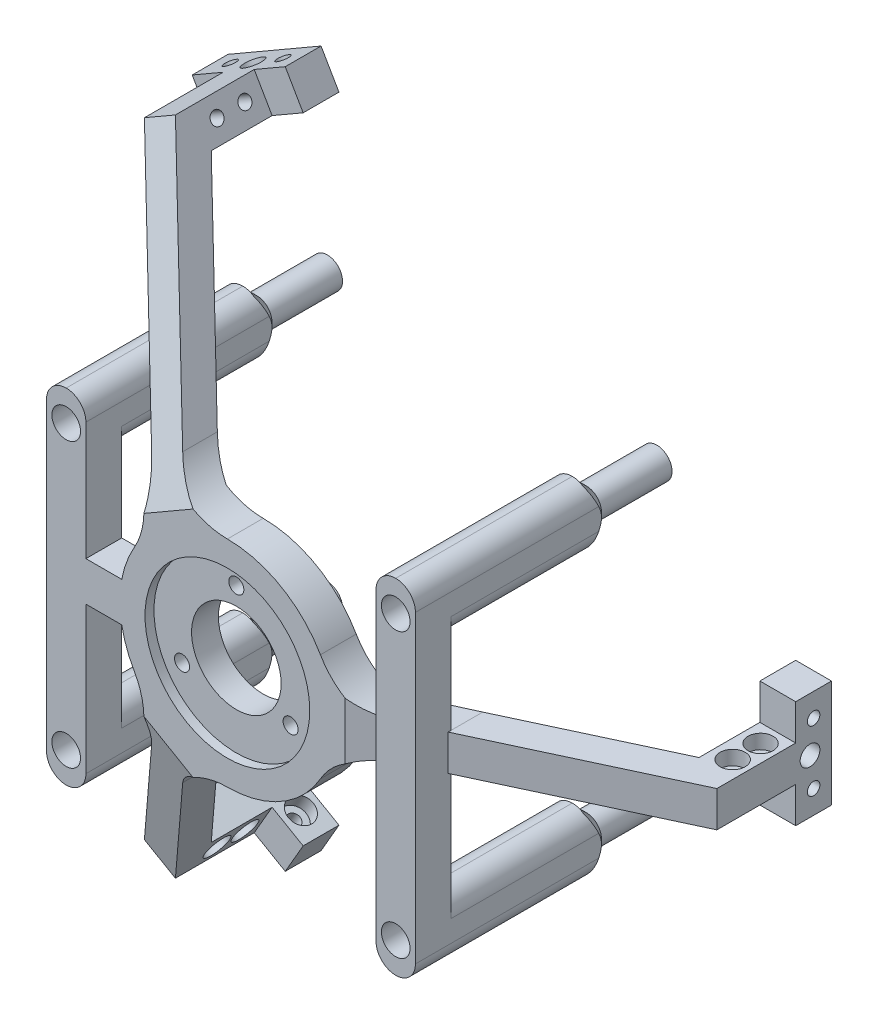
from build123d import *
from OCP.BRepFilletAPI import BRepFilletAPI_MakeChamfer

# Parameters (mm, degrees)
ESQUISSE1_W                    = 10
ESQUISSE1_H                    = 30
BOSS_EXTRU_1_DEPTH             = 10
BOSS_EXTRU_1_2_DEPTH           = 10
BOSS_EXTRU_1_3_DEPTH           = 10
ESQUISSE2_W                    = 10
ESQUISSE2_H                    = 10
BOSS_EXTRU_2_DEPTH             = 45
BOSS_EXTRU_3_DEPTH             = 10
CHANFREIN1_SIZE                = 28
CHANFREIN1_SIZE2               = 60.046193774
CHANFREIN2_SIZE                = 33
CHANFREIN2_SIZE2               = 70.768728377
CONG_1_R                       = 20
ENL_V_MAT_EXTRU_1_REACH        = 158.32
ESQUISSE4_R                    = 12.5
ESQUISSE5_R                    = 23
ENL_V_MAT_EXTRU_2_DEPTH        = 2.5
ENL_V_MAT_EXTRU_3_REACH        = 157.297
ESQUISSE6_R                    = 2.1
ESQUISSE7_W                    = 11
ESQUISSE7_H                    = 96
BOSS_EXTRU_4_DEPTH             = 39.3
BOSS_EXTRU_4_DIRECTION_2_REACH = 154.434
ENL_V_MAT_EXTRU_4_REACH        = 152.471
ESQUISSE8_R                    = 4
ESQUISSE18_R                   = 4.25
ESQUISSE18_R_2                 = 2.5
BOSS_EXTRU_6_DEPTH             = 15
CHANFREIN3_SIZE                = 3.9
ESQUISSE19_R                   = 4.25
ESQUISSE19_R_2                 = 1.5
BOSS_EXTRU_7_DEPTH             = 8.6
ESQUISSE10_W                   = 21.008475794
ESQUISSE10_H                   = 62
ESQUISSE10_W_2                 = 11
ENL_V_MAT_EXTRU_6_DEPTH        = 39.3
BOSS_EXTRU_5_REACH             = 157.459
CONG_2_R                       = 5.5
ENL_V_MAT_EXTRU_7_REACH        = 157.079
ESQUISSE11_R                   = 1.75
ESQUISSE12_R                   = 3.5
ENL_V_MAT_EXTRU_8_DEPTH        = 4
ENL_V_MAT_EXTRU_9_REACH        = 244.289
ESQUISSE13_R                   = 1.75
ESQUISSE14_R                   = 3.5
ENL_V_MAT_EXTRU_10_DEPTH       = 4
ENL_V_MAT_EXTRU_11_REACH       = 244.289
ESQUISSE15_R                   = 2.75
R_P_TITION_CIRCULAIRE1_COUNT   = 3


# Some blends are built 0.0001 mm under size
with BuildPart() as part:
    # Esquisse1 → Boss.-Extru.1 (new body)
    with BuildSketch(Plane.XY):
        with Locations((98.67, 0)):
            Rectangle(ESQUISSE1_W, ESQUISSE1_H)
    extrude(amount=BOSS_EXTRU_1_DEPTH)



with BuildPart() as body_2:
    # Esquisse1 → Boss.-Extru.1 2 (new body)
    with BuildSketch(Plane.XY):
        Polygon((-33.844618943, -88.620599572), (-59.825381057, -73.620599572), (-64.825381057, -82.28085361), (-38.844618943, -97.28085361), align=None)
    extrude(amount=BOSS_EXTRU_1_2_DEPTH)


with BuildPart() as body_3:
    # Esquisse1 → Boss.-Extru.1 3 (new body)
    with BuildSketch(Plane.XY):
        Polygon((-59.825381057, 73.620599572), (-33.844618943, 88.620599572), (-38.844618943, 97.28085361), (-64.825381057, 82.28085361), align=None)
    extrude(amount=BOSS_EXTRU_1_3_DEPTH)


with BuildPart() as part_1:
    add(part.part)

    add(body_2.part)  # Boss.-Extru.2 merges body 2

    add(body_3.part)  # Boss.-Extru.2 merges body 3
    # Esquisse2 → Boss.-Extru.2 (add)
    with BuildSketch(Plane.XY.offset(10)):
        Polygon((-47.504872981, 92.28085361), (-56.165127019, 87.28085361), (-51.165127019, 78.620599572), (-42.504872981, 83.620599572), align=None)
        with Locations((98.67, 0)):
            Rectangle(ESQUISSE2_W, ESQUISSE2_H)
        Polygon((-42.504872981, -83.620599572), (-51.165127019, -78.620599572), (-56.165127019, -87.28085361), (-47.504872981, -92.28085361), align=None)
    extrude(amount=BOSS_EXTRU_2_DEPTH)

    # Esquisse3 → Boss.-Extru.3 (add)
    with BuildSketch(Plane.XY.offset(55)):
        with BuildLine():
            Line((103.67, 5), (103.67, -5))
            Line((103.67, -5), (29.580398915, -5))
            ThreePointArc((29.580398915, -5), (15, -25.980762114), (-10.460072439, -28.117376915))
            Line((-10.460072439, -28.117376915), (-47.504872981, -92.28085361))
            Line((-47.504872981, -92.28085361), (-56.165127019, -87.28085361))
            Line((-56.165127019, -87.28085361), (-19.120326477, -23.117376915))
            ThreePointArc((-19.120326477, -23.117376915), (-30, 0), (-19.120326477, 23.117376915))
            Line((-19.120326477, 23.117376915), (-56.165127019, 87.28085361))
            Line((-56.165127019, 87.28085361), (-47.504872981, 92.28085361))
            Line((-47.504872981, 92.28085361), (-10.460072439, 28.117376915))
            ThreePointArc((-10.460072439, 28.117376915), (15, 25.980762114), (29.580398915, 5))
            Line((29.580398915, 5), (103.67, 5))
        make_face()
    extrude(amount=BOSS_EXTRU_3_DEPTH)

    # Chanfrein1: one chamfer whose edges measure the first distance from different faces: ONE call of the kernel's chamfer builder (chamfer() names one face for all edges)
    chanfrein1_edges_1 = [part_1.edges().sort_by_distance(p)[0] for p in [
        (93.67, 0, 55),
    ]]
    chanfrein1_side_1 = [part_1.faces().sort_by_distance(p)[0] for p in [
        (93.67, 0, 21.5),
    ]]
    chanfrein1_edges_2 = [part_1.edges().sort_by_distance(p)[0] for p in [
        (-46.835, -81.120599572, 55),
    ]]
    chanfrein1_side_2 = [part_1.faces().sort_by_distance(p)[0] for p in [
        (-46.835, -81.120599572, 21.5),
    ]]
    chanfrein1_edges_3 = [part_1.edges().sort_by_distance(p)[0] for p in [
        (-46.835, 81.120599572, 55),
    ]]
    chanfrein1_side_3 = [part_1.faces().sort_by_distance(p)[0] for p in [
        (-46.835, 81.120599572, 21.5),
    ]]
    chanfrein1 = BRepFilletAPI_MakeChamfer(part_1.part.solid().wrapped)
    for e in chanfrein1_edges_1:
        chanfrein1.Add(CHANFREIN1_SIZE, CHANFREIN1_SIZE2, e.wrapped, chanfrein1_side_1[0].wrapped)  # the first distance lies on this face
    for e in chanfrein1_edges_2:
        chanfrein1.Add(CHANFREIN1_SIZE, CHANFREIN1_SIZE2, e.wrapped, chanfrein1_side_2[0].wrapped)  # the first distance lies on this face
    for e in chanfrein1_edges_3:
        chanfrein1.Add(CHANFREIN1_SIZE, CHANFREIN1_SIZE2, e.wrapped, chanfrein1_side_3[0].wrapped)  # the first distance lies on this face
    add(Compound.cast(chanfrein1.Shape()), mode=Mode.REPLACE)

    # Chanfrein2: one chamfer whose edges measure the first distance from different faces: ONE call of the kernel's chamfer builder (chamfer() names one face for all edges)
    chanfrein2_edges_1 = [part_1.edges().sort_by_distance(p)[0] for p in [
        (-51.835, 89.78085361, 65),
    ]]
    chanfrein2_side_1 = [part_1.faces().sort_by_distance(p)[0] for p in [
        (-51.835, 89.78085361, 26.029411765),
    ]]
    chanfrein2_edges_2 = [part_1.edges().sort_by_distance(p)[0] for p in [
        (-51.835, -89.78085361, 65),
    ]]
    chanfrein2_side_2 = [part_1.faces().sort_by_distance(p)[0] for p in [
        (-51.835, -89.78085361, 26.029411765),
    ]]
    chanfrein2_edges_3 = [part_1.edges().sort_by_distance(p)[0] for p in [
        (103.67, 0, 65),
    ]]
    chanfrein2_side_3 = [part_1.faces().sort_by_distance(p)[0] for p in [
        (103.67, 0, 26.029411765),
    ]]
    chanfrein2 = BRepFilletAPI_MakeChamfer(part_1.part.solid().wrapped)
    for e in chanfrein2_edges_1:
        chanfrein2.Add(CHANFREIN2_SIZE, CHANFREIN2_SIZE2, e.wrapped, chanfrein2_side_1[0].wrapped)  # the first distance lies on this face
    for e in chanfrein2_edges_2:
        chanfrein2.Add(CHANFREIN2_SIZE, CHANFREIN2_SIZE2, e.wrapped, chanfrein2_side_2[0].wrapped)  # the first distance lies on this face
    for e in chanfrein2_edges_3:
        chanfrein2.Add(CHANFREIN2_SIZE, CHANFREIN2_SIZE2, e.wrapped, chanfrein2_side_3[0].wrapped)  # the first distance lies on this face
    add(Compound.cast(chanfrein2.Shape()), mode=Mode.REPLACE)

    # Congé1
    # the kernel refuses this fillet: 20 mm, written as the material it adds along each edge
    with BuildSketch(Plane(origin=(29.580398915, -5, 55), x_dir=(1, 0, 0), z_dir=(0, 0, 1))) as cong_1_piece_1_section:
        with BuildLine():
            CenterArc((13.720871274, -20), CONG_1_R, 90, 60)
            ThreePointArc((-3.599636802, -10), (-1.353449847, -5.160676467), (0, 0))
            Line((0, 0), (13.720871274, 0))
        make_face()
    cong_1_piece_1 = extrude(amount=10, mode=Mode.PRIVATE)
    cong_1_piece_1 = split(cong_1_piece_1, bisect_by=Plane(origin=(29.686956687, -8.874488786, 56.835783089), z_dir=(-0.42261826174069717, 0, -0.9063077870366512)), keep=Keep.TOP, mode=Mode.PRIVATE)
    add(cong_1_piece_1)
    with BuildSketch(Plane(origin=(29.580398915, -5, 20.697821816), x_dir=(1, 0, 0), z_dir=(0, 0, 1))) as cong_1_piece_2_section:
        with BuildLine():
            CenterArc((13.720871274, -20), CONG_1_R, 90, 60)
            ThreePointArc((-3.599636802, -10), (-1.353449847, -5.160676467), (0, 0))
            Line((0, 0), (13.720871274, 0))
        make_face()
    cong_1_piece_2 = extrude(amount=44.302178184, mode=Mode.PRIVATE)
    cong_1_piece_2 = split(cong_1_piece_2, bisect_by=Plane(origin=(38.771114589, -5.14420789, 55), z_dir=(0, 0, -1)), keep=Keep.TOP, mode=Mode.PRIVATE)
    cong_1_piece_2 = split(cong_1_piece_2, bisect_by=Plane(origin=(38.311444008, -5.14420789, 52.814118603), z_dir=(0.42261826174069717, 0, 0.9063077870366512)), keep=Keep.TOP, mode=Mode.PRIVATE)
    add(cong_1_piece_2)
    with BuildSketch(Plane(origin=(29.580398915, -5, 55), x_dir=(1, 0, 0), z_dir=(0, 0, 1))) as cong_1_piece_3_section:
        with BuildLine():
            CenterArc((13.720871274, -20), CONG_1_R, 90, 60)
            ThreePointArc((-3.599636802, -10), (-1.353449847, -5.160676467), (0, 0))
            Line((0, 0), (13.720871274, 0))
        make_face()
    cong_1_piece_3 = extrude(amount=10, mode=Mode.PRIVATE)
    cong_1_piece_3 = split(cong_1_piece_3, bisect_by=Plane(origin=(34.156961746, -7.089474208, 64.41446208), z_dir=(-0.42261826174069717, 0, -0.906307787036651)), keep=Keep.TOP, mode=Mode.PRIVATE)
    cong_1_piece_3 = split(cong_1_piece_3, bisect_by=Plane(origin=(30.455788686, -7.089474208, 56.47727084), z_dir=(0.42261826174069717, 0, 0.9063077870366512)), keep=Keep.TOP, mode=Mode.PRIVATE)
    add(cong_1_piece_3)
    with BuildSketch(Plane(origin=(-10.460072439, -28.117376915, 20.697821816), x_dir=(0.984186439950099, -0.17713568646196043, 0), z_dir=(0, 0, 1))) as cong_1_piece_4_section:
        with BuildLine():
            CenterArc((14.170854917, -19.683728799), CONG_1_R, 100.202965887, 60)
            Line((-4.647111129, -12.909944487), (0, 0))
            ThreePointArc((0, 0), (5.314070594, -0.474406801), (10.628141188, 0))
        make_face()
    cong_1_piece_4 = extrude(amount=44.302178184, mode=Mode.PRIVATE)
    cong_1_piece_4 = split(cong_1_piece_4, bisect_by=Plane(origin=(-14.930542581, -36.148874113, 55), z_dir=(0, 0, -1)), keep=Keep.TOP, mode=Mode.PRIVATE)
    cong_1_piece_4 = split(cong_1_piece_4, bisect_by=Plane(origin=(-14.700707291, -35.750787713, 52.814118603), z_dir=(-0.21130913087034803, -0.3659981507706655, 0.906307787036651)), keep=Keep.TOP, mode=Mode.PRIVATE)
    add(cong_1_piece_4)
    with BuildSketch(Plane(origin=(-10.460072439, -28.117376915, 55), x_dir=(0.9841864399500992, -0.17713568646195998, 0), z_dir=(0, 0, 1))) as cong_1_piece_5_section:
        with BuildLine():
            CenterArc((14.170854917, -19.683728799), CONG_1_R, 100.202965887, 60)
            Line((-4.647111129, -12.909944487), (0, 0))
            ThreePointArc((0, 0), (5.314070594, -0.474406801), (10.628141188, 0))
        make_face()
    cong_1_piece_5 = extrude(amount=10, mode=Mode.PRIVATE)
    cong_1_piece_5 = split(cong_1_piece_5, bisect_by=Plane(origin=(-7.157945608, -30.146903047, 56.835783088), z_dir=(0.21130913087034803, 0.3659981507706655, -0.906307787036651)), keep=Keep.TOP, mode=Mode.PRIVATE)
    add(cong_1_piece_5)
    with BuildSketch(Plane(origin=(-10.460072439, -28.117376915, 55), x_dir=(0.9841864399500992, -0.17713568646195998, 0), z_dir=(0, 0, 1))) as cong_1_piece_6_section:
        with BuildLine():
            CenterArc((14.170854917, -19.683728799), CONG_1_R, 100.202965887, 60)
            Line((-4.647111129, -12.909944487), (0, 0))
            ThreePointArc((0, 0), (5.314070594, -0.474406801), (10.628141188, 0))
        make_face()
    cong_1_piece_6 = extrude(amount=10, mode=Mode.PRIVATE)
    cong_1_piece_6 = split(cong_1_piece_6, bisect_by=Plane(origin=(-10.938816109, -33.125533693, 64.414462079), z_dir=(0.21130913087034933, 0.3659981507706645, -0.906307787036651)), keep=Keep.TOP, mode=Mode.PRIVATE)
    cong_1_piece_6 = split(cong_1_piece_6, bisect_by=Plane(origin=(-9.088229579, -29.9202238, 56.477270839), z_dir=(-0.21130913087034803, -0.3659981507706655, 0.906307787036651)), keep=Keep.TOP, mode=Mode.PRIVATE)
    add(cong_1_piece_6)
    with BuildSketch(Plane(origin=(-19.120326477, -23.117376915, 20.697821816), x_dir=(-0.6454972243679025, 0.7637626158259736, 0), z_dir=(0, 0, 1))) as cong_1_piece_7_section:
        with BuildLine():
            CenterArc((14.170854917, 19.683728799), CONG_1_R, 199.797034113, 60)
            Line((-4.647111129, 12.909944487), (0, 0))
            ThreePointArc((0, 0), (5.314070594, 0.474406801), (10.628141188, 0))
        make_face()
    cong_1_piece_7 = extrude(amount=44.302178184, mode=Mode.PRIVATE)
    cong_1_piece_7 = split(cong_1_piece_7, bisect_by=Plane(origin=(-23.84057201, -31.004666224, 55), z_dir=(0, 0, -1)), keep=Keep.TOP, mode=Mode.PRIVATE)
    cong_1_piece_7 = split(cong_1_piece_7, bisect_by=Plane(origin=(-23.610736719, -30.606579824, 52.814118603), z_dir=(-0.21130913087034803, -0.3659981507706655, 0.906307787036651)), keep=Keep.TOP, mode=Mode.PRIVATE)
    add(cong_1_piece_7)
    with BuildSketch(Plane(origin=(-19.120326477, -23.117376915, 55), x_dir=(-0.6454972243679029, 0.7637626158259734, 0), z_dir=(0, 0, 1))) as cong_1_piece_8_section:
        with BuildLine():
            CenterArc((14.170854917, 19.683728799), CONG_1_R, 199.797034113, 60)
            Line((-4.647111129, 12.909944487), (0, 0))
            ThreePointArc((0, 0), (5.314070594, 0.474406801), (10.628141188, 0))
        make_face()
    cong_1_piece_8 = extrude(amount=10, mode=Mode.PRIVATE)
    cong_1_piece_8 = split(cong_1_piece_8, bisect_by=Plane(origin=(-22.529011081, -21.272414259, 56.835783088), z_dir=(0.21130913087034803, 0.3659981507706655, -0.906307787036651)), keep=Keep.TOP, mode=Mode.PRIVATE)
    add(cong_1_piece_8)
    with BuildSketch(Plane(origin=(-19.120326477, -23.117376915, 55), x_dir=(-0.6454972243679029, 0.7637626158259734, 0), z_dir=(0, 0, 1))) as cong_1_piece_9_section:
        with BuildLine():
            CenterArc((14.170854917, 19.683728799), CONG_1_R, 199.797034113, 60)
            Line((-4.647111129, 12.909944487), (0, 0))
            ThreePointArc((0, 0), (5.314070594, 0.474406801), (10.628141188, 0))
        make_face()
    cong_1_piece_9 = extrude(amount=10, mode=Mode.PRIVATE)
    cong_1_piece_9 = split(cong_1_piece_9, bisect_by=Plane(origin=(-23.218145637, -26.036059484, 64.414462079), z_dir=(0.21130913087034933, 0.3659981507706645, -0.906307787036651)), keep=Keep.TOP, mode=Mode.PRIVATE)
    cong_1_piece_9 = split(cong_1_piece_9, bisect_by=Plane(origin=(-21.367559108, -22.830749591, 56.477270839), z_dir=(-0.21130913087034803, -0.3659981507706655, 0.906307787036651)), keep=Keep.TOP, mode=Mode.PRIVATE)
    add(cong_1_piece_9)
    with BuildSketch(Plane(origin=(-19.120326477, 23.117376915, 55), x_dir=(-0.4999999999999981, 0.8660254037844398, 0), z_dir=(0, 0, 1))) as cong_1_piece_10_section:
        with BuildLine():
            CenterArc((13.720871274, 20), CONG_1_R, 210, 60)
            ThreePointArc((-3.599636802, 10), (-1.353449847, 5.160676467), (0, 0))
            Line((0, 0), (13.720871274, 0))
        make_face()
    cong_1_piece_10 = extrude(amount=10, mode=Mode.PRIVATE)
    cong_1_piece_10 = split(cong_1_piece_10, bisect_by=Plane(origin=(-22.529011078, 21.272414259, 56.835783089), z_dir=(0.21130913087034867, -0.36599815077066483, -0.906307787036651)), keep=Keep.TOP, mode=Mode.PRIVATE)
    add(cong_1_piece_10)
    with BuildSketch(Plane(origin=(-19.120326477, 23.117376915, 20.697821816), x_dir=(-0.5000000000000007, 0.8660254037844383, 0), z_dir=(0, 0, 1))) as cong_1_piece_11_section:
        with BuildLine():
            CenterArc((13.720871274, 20), CONG_1_R, 210, 60)
            ThreePointArc((-3.599636802, 10), (-1.353449847, 5.160676467), (0, 0))
            Line((0, 0), (13.720871274, 0))
        make_face()
    cong_1_piece_11 = extrude(amount=44.302178184, mode=Mode.PRIVATE)
    cong_1_piece_11 = split(cong_1_piece_11, bisect_by=Plane(origin=(-23.84057201, 31.004666222, 55), z_dir=(0, 0, -1)), keep=Keep.TOP, mode=Mode.PRIVATE)
    cong_1_piece_11 = split(cong_1_piece_11, bisect_by=Plane(origin=(-23.610736719, 30.606579822, 52.814118603), z_dir=(-0.21130913087034867, 0.36599815077066483, 0.906307787036651)), keep=Keep.TOP, mode=Mode.PRIVATE)
    add(cong_1_piece_11)
    with BuildSketch(Plane(origin=(-19.120326477, 23.117376915, 55), x_dir=(-0.4999999999999981, 0.8660254037844398, 0), z_dir=(0, 0, 1))) as cong_1_piece_12_section:
        with BuildLine():
            CenterArc((13.720871274, 20), CONG_1_R, 210, 60)
            ThreePointArc((-3.599636802, 10), (-1.353449847, 5.160676467), (0, 0))
            Line((0, 0), (13.720871274, 0))
        make_face()
    cong_1_piece_12 = extrude(amount=10, mode=Mode.PRIVATE)
    cong_1_piece_12 = split(cong_1_piece_12, bisect_by=Plane(origin=(-23.218145636, 26.036059484, 64.41446208), z_dir=(0.2113091308703489, -0.36599815077066467, -0.906307787036651)), keep=Keep.TOP, mode=Mode.PRIVATE)
    cong_1_piece_12 = split(cong_1_piece_12, bisect_by=Plane(origin=(-21.367559107, 22.830749591, 56.47727084), z_dir=(-0.21130913087034867, 0.36599815077066483, 0.906307787036651)), keep=Keep.TOP, mode=Mode.PRIVATE)
    add(cong_1_piece_12)
    with BuildSketch(Plane(origin=(29.580398915, 5, 55), x_dir=(1, 0, 0), z_dir=(0, 0, 1))) as cong_1_piece_13_section:
        with BuildLine():
            CenterArc((13.720871274, 20), CONG_1_R, 210, 60)
            ThreePointArc((-3.599636802, 10), (-1.353449847, 5.160676467), (0, 0))
            Line((0, 0), (13.720871274, 0))
        make_face()
    cong_1_piece_13 = extrude(amount=10, mode=Mode.PRIVATE)
    cong_1_piece_13 = split(cong_1_piece_13, bisect_by=Plane(origin=(29.686956687, 8.874488786, 56.835783089), z_dir=(-0.42261826174069717, 0, -0.9063077870366512)), keep=Keep.TOP, mode=Mode.PRIVATE)
    add(cong_1_piece_13)
    with BuildSketch(Plane(origin=(29.580398915, 5, 20.697821816), x_dir=(1, 0, 0), z_dir=(0, 0, 1))) as cong_1_piece_14_section:
        with BuildLine():
            CenterArc((13.720871274, 20), CONG_1_R, 210, 60)
            ThreePointArc((-3.599636802, 10), (-1.353449847, 5.160676467), (0, 0))
            Line((0, 0), (13.720871274, 0))
        make_face()
    cong_1_piece_14 = extrude(amount=44.302178184, mode=Mode.PRIVATE)
    cong_1_piece_14 = split(cong_1_piece_14, bisect_by=Plane(origin=(38.771114589, 5.14420789, 55), z_dir=(0, 0, -1)), keep=Keep.TOP, mode=Mode.PRIVATE)
    cong_1_piece_14 = split(cong_1_piece_14, bisect_by=Plane(origin=(38.311444008, 5.14420789, 52.814118603), z_dir=(0.42261826174069717, 0, 0.9063077870366512)), keep=Keep.TOP, mode=Mode.PRIVATE)
    add(cong_1_piece_14)
    with BuildSketch(Plane(origin=(29.580398915, 5, 55), x_dir=(1, 0, 0), z_dir=(0, 0, 1))) as cong_1_piece_15_section:
        with BuildLine():
            CenterArc((13.720871274, 20), CONG_1_R, 210, 60)
            ThreePointArc((-3.599636802, 10), (-1.353449847, 5.160676467), (0, 0))
            Line((0, 0), (13.720871274, 0))
        make_face()
    cong_1_piece_15 = extrude(amount=10, mode=Mode.PRIVATE)
    cong_1_piece_15 = split(cong_1_piece_15, bisect_by=Plane(origin=(34.156961746, 7.089474208, 64.41446208), z_dir=(-0.42261826174069717, 0, -0.906307787036651)), keep=Keep.TOP, mode=Mode.PRIVATE)
    cong_1_piece_15 = split(cong_1_piece_15, bisect_by=Plane(origin=(30.455788686, 7.089474208, 56.47727084), z_dir=(0.42261826174069717, 0, 0.9063077870366512)), keep=Keep.TOP, mode=Mode.PRIVATE)
    add(cong_1_piece_15)
    with BuildSketch(Plane(origin=(-10.460072439, 28.117376915, 20.697821816), x_dir=(0.9841864399500989, 0.17713568646196104, 0), z_dir=(0, 0, 1))) as cong_1_piece_16_section:
        with BuildLine():
            CenterArc((14.170854917, 19.683728799), CONG_1_R, 199.797034113, 60)
            Line((-4.647111129, 12.909944487), (0, 0))
            ThreePointArc((0, 0), (5.314070594, 0.474406801), (10.628141188, 0))
        make_face()
    cong_1_piece_16 = extrude(amount=44.302178184, mode=Mode.PRIVATE)
    cong_1_piece_16 = split(cong_1_piece_16, bisect_by=Plane(origin=(-14.930542581, 36.148874113, 55), z_dir=(0, 0, -1)), keep=Keep.TOP, mode=Mode.PRIVATE)
    cong_1_piece_16 = split(cong_1_piece_16, bisect_by=Plane(origin=(-14.700707291, 35.750787713, 52.814118603), z_dir=(-0.21130913087034867, 0.36599815077066483, 0.906307787036651)), keep=Keep.TOP, mode=Mode.PRIVATE)
    add(cong_1_piece_16)
    with BuildSketch(Plane(origin=(-10.460072439, 28.117376915, 55), x_dir=(0.9841864399500989, 0.1771356864619613, 0), z_dir=(0, 0, 1))) as cong_1_piece_17_section:
        with BuildLine():
            CenterArc((14.170854917, 19.683728799), CONG_1_R, 199.797034113, 60)
            Line((-4.647111129, 12.909944487), (0, 0))
            ThreePointArc((0, 0), (5.314070594, 0.474406801), (10.628141188, 0))
        make_face()
    cong_1_piece_17 = extrude(amount=10, mode=Mode.PRIVATE)
    cong_1_piece_17 = split(cong_1_piece_17, bisect_by=Plane(origin=(-7.157945608, 30.146903047, 56.835783088), z_dir=(0.21130913087034867, -0.36599815077066483, -0.906307787036651)), keep=Keep.TOP, mode=Mode.PRIVATE)
    add(cong_1_piece_17)
    with BuildSketch(Plane(origin=(-10.460072439, 28.117376915, 55), x_dir=(0.9841864399500989, 0.1771356864619613, 0), z_dir=(0, 0, 1))) as cong_1_piece_18_section:
        with BuildLine():
            CenterArc((14.170854917, 19.683728799), CONG_1_R, 199.797034113, 60)
            Line((-4.647111129, 12.909944487), (0, 0))
            ThreePointArc((0, 0), (5.314070594, 0.474406801), (10.628141188, 0))
        make_face()
    cong_1_piece_18 = extrude(amount=10, mode=Mode.PRIVATE)
    cong_1_piece_18 = split(cong_1_piece_18, bisect_by=Plane(origin=(-10.938816109, 33.125533693, 64.414462079), z_dir=(0.2113091308703489, -0.36599815077066467, -0.906307787036651)), keep=Keep.TOP, mode=Mode.PRIVATE)
    cong_1_piece_18 = split(cong_1_piece_18, bisect_by=Plane(origin=(-9.088229579, 29.9202238, 56.477270839), z_dir=(-0.21130913087034867, 0.36599815077066483, 0.906307787036651)), keep=Keep.TOP, mode=Mode.PRIVATE)
    add(cong_1_piece_18)

    # Esquisse4 → Enlèv. mat.-Extru.1 (cut, up to next)
    with BuildSketch(Plane.XY.offset(65), mode=Mode.PRIVATE) as enl_v_mat_extru_1_sk1:
        Circle(ESQUISSE4_R)
    enl_v_mat_extru_1_tool1 = extrude(enl_v_mat_extru_1_sk1.sketch, amount=-ENL_V_MAT_EXTRU_1_REACH, mode=Mode.PRIVATE) & part_1.part
    add(enl_v_mat_extru_1_tool1.solids().sort_by_distance((0, 0, 65))[0], mode=Mode.SUBTRACT)

    # Esquisse5 → Enlèv. mat.-Extru.2 (cut)
    with BuildSketch(Plane.XY.offset(65)):
        Circle(ESQUISSE5_R)
    extrude(amount=-ENL_V_MAT_EXTRU_2_DEPTH, mode=Mode.SUBTRACT)

    # Esquisse6 → Enlèv. mat.-Extru.3 (cut, up to next)
    with BuildSketch(Plane.XY.offset(62.5), mode=Mode.PRIVATE) as enl_v_mat_extru_3_sk1:
        with Locations((0, 17.5)):
            Circle(ESQUISSE6_R)
    enl_v_mat_extru_3_tool1 = extrude(enl_v_mat_extru_3_sk1.sketch, amount=-ENL_V_MAT_EXTRU_3_REACH, mode=Mode.PRIVATE) & part_1.part
    # Esquisse6 → Enlèv. mat.-Extru.3 (cut, up to next)
    with BuildSketch(Plane.XY.offset(62.5), mode=Mode.PRIVATE) as enl_v_mat_extru_3_sk2:
        with Locations((15.155444566, -8.75)):
            Circle(ESQUISSE6_R)
    enl_v_mat_extru_3_tool2 = extrude(enl_v_mat_extru_3_sk2.sketch, amount=-ENL_V_MAT_EXTRU_3_REACH, mode=Mode.PRIVATE) & part_1.part
    # Esquisse6 → Enlèv. mat.-Extru.3 (cut, up to next)
    with BuildSketch(Plane.XY.offset(62.5), mode=Mode.PRIVATE) as enl_v_mat_extru_3_sk3:
        with Locations((-15.155444566, -8.75)):
            Circle(ESQUISSE6_R)
    enl_v_mat_extru_3_tool3 = extrude(enl_v_mat_extru_3_sk3.sketch, amount=-ENL_V_MAT_EXTRU_3_REACH, mode=Mode.PRIVATE) & part_1.part
    add(enl_v_mat_extru_3_tool1.solids().sort_by_distance((0, 17.5, 62.5))[0], mode=Mode.SUBTRACT)
    add(enl_v_mat_extru_3_tool2.solids().sort_by_distance((15.155445, -8.75, 62.5))[0], mode=Mode.SUBTRACT)
    add(enl_v_mat_extru_3_tool3.solids().sort_by_distance((-15.155445, -8.75, 62.5))[0], mode=Mode.SUBTRACT)

    # Esquisse7 → Boss.-Extru.4 (add)
    with BuildSketch(Plane(origin=(0, 0, 55), x_dir=(-1, 0, 0), z_dir=(0, 0, -1))):
        with Locations((-47, -4)):
            Rectangle(ESQUISSE7_W, ESQUISSE7_H)
        with BuildLine():
            Line((50.5, -52), (39.5, -52))
            Line((39.5, -52), (39.5, -5.5))
            Line((39.5, -5.5), (29.491524206, -5.5))
            ThreePointArc((29.491524206, -5.5), (30, 0), (29.491524206, 5.5))
            Line((29.491524206, 5.5), (39.5, 5.5))
            Line((39.5, 5.5), (39.5, 44))
            Line((39.5, 44), (50.5, 44))
            Line((50.5, 44), (50.5, -52))
        make_face()
    extrude(amount=BOSS_EXTRU_4_DEPTH)

    # Boss.-Extru.4 direction 2: up to this face of the body (flat: up to its plane)
    boss_extru_4_direction_2_end = Plane(part_1.part.faces().sort_by_distance((-10.405638932, 30.939769239, 65))[0])
    # Esquisse7 → Boss.-Extru.4 direction 2 (add, up to the picked face)
    with BuildSketch(Plane(origin=(0, 0, 55), x_dir=(-1, 0, 0), z_dir=(0, 0, -1)), mode=Mode.PRIVATE) as boss_extru_4_direction_2_sk1:
        with Locations((-47, -4)):
            Rectangle(ESQUISSE7_W, ESQUISSE7_H)
    boss_extru_4_direction_2_tool1 = split(extrude(boss_extru_4_direction_2_sk1.sketch, amount=-BOSS_EXTRU_4_DIRECTION_2_REACH, mode=Mode.PRIVATE), bisect_by=boss_extru_4_direction_2_end, keep=Keep.BOTH, mode=Mode.PRIVATE)
    # Esquisse7 → Boss.-Extru.4 direction 2 (add, up to the picked face)
    with BuildSketch(Plane(origin=(0, 0, 55), x_dir=(-1, 0, 0), z_dir=(0, 0, -1)), mode=Mode.PRIVATE) as boss_extru_4_direction_2_sk2:
        with BuildLine():
            Line((50.5, -52), (39.5, -52))
            Line((39.5, -52), (39.5, -5.5))
            Line((39.5, -5.5), (29.491524206, -5.5))
            ThreePointArc((29.491524206, -5.5), (30, 0), (29.491524206, 5.5))
            Line((29.491524206, 5.5), (39.5, 5.5))
            Line((39.5, 5.5), (39.5, 44))
            Line((39.5, 44), (50.5, 44))
            Line((50.5, 44), (50.5, -52))
        make_face()
    boss_extru_4_direction_2_tool2 = split(extrude(boss_extru_4_direction_2_sk2.sketch, amount=-BOSS_EXTRU_4_DIRECTION_2_REACH, mode=Mode.PRIVATE), bisect_by=boss_extru_4_direction_2_end, keep=Keep.BOTH, mode=Mode.PRIVATE)
    add(boss_extru_4_direction_2_tool1.solids().sort_by(Axis((47, -4, 55), (0, 0, 1)))[0])
    add(boss_extru_4_direction_2_tool2.solids().sort_by(Axis((-44.054268, -3.633992, 55), (0, 0, 1)))[0])

    # Esquisse8 → Enlèv. mat.-Extru.4 (cut, up to next)
    with BuildSketch(Plane(origin=(0, 0, 15.7), x_dir=(-1, 0, 0), z_dir=(0, 0, -1)), mode=Mode.PRIVATE) as enl_v_mat_extru_4_sk1:
        with Locations((45, 35.5)):
            Circle(ESQUISSE8_R)
    enl_v_mat_extru_4_tool1 = extrude(enl_v_mat_extru_4_sk1.sketch, amount=-ENL_V_MAT_EXTRU_4_REACH, mode=Mode.PRIVATE) & part_1.part
    # Esquisse8 → Enlèv. mat.-Extru.4 (cut, up to next)
    with BuildSketch(Plane(origin=(0, 0, 15.7), x_dir=(-1, 0, 0), z_dir=(0, 0, -1)), mode=Mode.PRIVATE) as enl_v_mat_extru_4_sk2:
        with Locations((-47, 35.5)):
            Circle(ESQUISSE8_R)
    enl_v_mat_extru_4_tool2 = extrude(enl_v_mat_extru_4_sk2.sketch, amount=-ENL_V_MAT_EXTRU_4_REACH, mode=Mode.PRIVATE) & part_1.part
    # Esquisse8 → Enlèv. mat.-Extru.4 (cut, up to next)
    with BuildSketch(Plane(origin=(0, 0, 15.7), x_dir=(-1, 0, 0), z_dir=(0, 0, -1)), mode=Mode.PRIVATE) as enl_v_mat_extru_4_sk3:
        with Locations((-47, -43.5)):
            Circle(ESQUISSE8_R)
    enl_v_mat_extru_4_tool3 = extrude(enl_v_mat_extru_4_sk3.sketch, amount=-ENL_V_MAT_EXTRU_4_REACH, mode=Mode.PRIVATE) & part_1.part
    # Esquisse8 → Enlèv. mat.-Extru.4 (cut, up to next)
    with BuildSketch(Plane(origin=(0, 0, 15.7), x_dir=(-1, 0, 0), z_dir=(0, 0, -1)), mode=Mode.PRIVATE) as enl_v_mat_extru_4_sk4:
        with Locations((45, -43.5)):
            Circle(ESQUISSE8_R)
    enl_v_mat_extru_4_tool4 = extrude(enl_v_mat_extru_4_sk4.sketch, amount=-ENL_V_MAT_EXTRU_4_REACH, mode=Mode.PRIVATE) & part_1.part
    add(enl_v_mat_extru_4_tool1.solids().sort_by_distance((-45, 35.5, 15.7))[0], mode=Mode.SUBTRACT)
    add(enl_v_mat_extru_4_tool2.solids().sort_by_distance((47, 35.5, 15.7))[0], mode=Mode.SUBTRACT)
    add(enl_v_mat_extru_4_tool3.solids().sort_by_distance((47, -43.5, 15.7))[0], mode=Mode.SUBTRACT)
    add(enl_v_mat_extru_4_tool4.solids().sort_by_distance((-45, -43.5, 15.7))[0], mode=Mode.SUBTRACT)

    # Esquisse18 → Boss.-Extru.6 (add)
    # profile 1 of 4: a face of its own
    with BuildSketch(Plane(origin=(0, 0, 15.7), x_dir=(-1, 0, 0), z_dir=(0, 0, -1))):
        with Locations((-47, 35.5)):
            Circle(ESQUISSE18_R)
        with Locations((-47, 35.5)):
            Circle(ESQUISSE18_R_2, mode=Mode.SUBTRACT)
    # profile 2 of 4: a face of its own
    with BuildSketch(Plane(origin=(0, 0, 15.7), x_dir=(-1, 0, 0), z_dir=(0, 0, -1))):
        with Locations((-47, -43.5)):
            Circle(ESQUISSE18_R)
        with Locations((-47, -43.5)):
            Circle(ESQUISSE18_R_2, mode=Mode.SUBTRACT)
    # profile 3 of 4: a face of its own
    with BuildSketch(Plane(origin=(0, 0, 15.7), x_dir=(-1, 0, 0), z_dir=(0, 0, -1))):
        with Locations((45, 35.5)):
            Circle(ESQUISSE18_R)
        with Locations((45, 35.5)):
            Circle(ESQUISSE18_R_2, mode=Mode.SUBTRACT)
    # profile 4 of 4: a face of its own
    with BuildSketch(Plane(origin=(0, 0, 15.7), x_dir=(-1, 0, 0), z_dir=(0, 0, -1))):
        with Locations((45, -43.5)):
            Circle(ESQUISSE18_R)
        with Locations((45, -43.5)):
            Circle(ESQUISSE18_R_2, mode=Mode.SUBTRACT)
    extrude(amount=BOSS_EXTRU_6_DEPTH)

    # Chanfrein3
    # the kernel refuses this chamfer: 3.9 mm, written as the material it adds along each edge
    with BuildSketch(Plane(origin=(47, 35.5, 15.7), x_dir=(-1, 0, 0), z_dir=(0, -1, 0))) as chanfrein3_piece_1_section:
        Polygon((4.25 + CHANFREIN3_SIZE, 0), (4.25, CHANFREIN3_SIZE), (4.25, 0), align=None)
    chanfrein3_piece_1 = revolve(axis=Axis((47, 35.5, 15.7), (0, 0, -1)), mode=Mode.PRIVATE)
    chanfrein3_piece_1 = split(chanfrein3_piece_1, bisect_by=Plane(origin=(41.5, 42.020797732, 15.167509558), z_dir=(1, 0, 0)), keep=Keep.TOP, mode=Mode.PRIVATE)
    chanfrein3_piece_1 = split(chanfrein3_piece_1, bisect_by=Plane(origin=(52.5, 42.020797732, 15.167509558), z_dir=(-1, 0, 0)), keep=Keep.TOP, mode=Mode.PRIVATE)
    add(chanfrein3_piece_1)
    with BuildSketch(Plane(origin=(47, -43.5, 15.7), x_dir=(-1, 0, 0), z_dir=(0, -1, 0))) as chanfrein3_piece_2_section:
        Polygon((4.25 + CHANFREIN3_SIZE, 0), (4.25, CHANFREIN3_SIZE), (4.25, 0), align=None)
    chanfrein3_piece_2 = revolve(axis=Axis((47, -43.5, 15.7), (0, 0, -1)), mode=Mode.PRIVATE)
    chanfrein3_piece_2 = split(chanfrein3_piece_2, bisect_by=Plane(origin=(41.5, -36.979202268, 15.167509558), z_dir=(1, 0, 0)), keep=Keep.TOP, mode=Mode.PRIVATE)
    chanfrein3_piece_2 = split(chanfrein3_piece_2, bisect_by=Plane(origin=(52.5, -36.979202268, 15.167509558), z_dir=(-1, 0, 0)), keep=Keep.TOP, mode=Mode.PRIVATE)
    add(chanfrein3_piece_2)
    with BuildSketch(Plane(origin=(-45, 35.5, 15.7), x_dir=(-1, 0, 0), z_dir=(0, -1, 0))) as chanfrein3_piece_3_section:
        Polygon((4.25 + CHANFREIN3_SIZE, 0), (4.25, CHANFREIN3_SIZE), (4.25, 0), align=None)
    chanfrein3_piece_3 = revolve(axis=Axis((-45, 35.5, 15.7), (0, 0, -1)), mode=Mode.PRIVATE)
    chanfrein3_piece_3 = split(chanfrein3_piece_3, bisect_by=Plane(origin=(-39.5, 42.020797732, 15.167509558), z_dir=(-1, 0, 0)), keep=Keep.TOP, mode=Mode.PRIVATE)
    chanfrein3_piece_3 = split(chanfrein3_piece_3, bisect_by=Plane(origin=(-50.5, 42.020797732, 15.167509558), z_dir=(1, 0, 0)), keep=Keep.TOP, mode=Mode.PRIVATE)
    add(chanfrein3_piece_3)
    with BuildSketch(Plane(origin=(-45, -43.5, 15.7), x_dir=(-1, 0, 0), z_dir=(0, -1, 0))) as chanfrein3_piece_4_section:
        Polygon((4.25 + CHANFREIN3_SIZE, 0), (4.25, CHANFREIN3_SIZE), (4.25, 0), align=None)
    chanfrein3_piece_4 = revolve(axis=Axis((-45, -43.5, 15.7), (0, 0, -1)), mode=Mode.PRIVATE)
    chanfrein3_piece_4 = split(chanfrein3_piece_4, bisect_by=Plane(origin=(-50.5, -36.979202268, 15.167509558), z_dir=(1, 0, 0)), keep=Keep.TOP, mode=Mode.PRIVATE)
    chanfrein3_piece_4 = split(chanfrein3_piece_4, bisect_by=Plane(origin=(-39.5, -36.979202268, 15.167509558), z_dir=(-1, 0, 0)), keep=Keep.TOP, mode=Mode.PRIVATE)
    add(chanfrein3_piece_4)

    # Esquisse19 → Boss.-Extru.7 (add)
    # profile 1 of 4: a face of its own
    with BuildSketch(Plane(origin=(0, 0, 0.7), x_dir=(-1, 0, 0), z_dir=(0, 0, -1))):
        with Locations((-47, -43.5)):
            Circle(ESQUISSE19_R)
        with Locations((-47, -43.5)):
            Circle(ESQUISSE19_R_2, mode=Mode.SUBTRACT)
    # profile 2 of 4: a face of its own
    with BuildSketch(Plane(origin=(0, 0, 0.7), x_dir=(-1, 0, 0), z_dir=(0, 0, -1))):
        with Locations((-47, 35.5)):
            Circle(ESQUISSE19_R)
        with Locations((-47, 35.5)):
            Circle(ESQUISSE19_R_2, mode=Mode.SUBTRACT)
    # profile 3 of 4: a face of its own
    with BuildSketch(Plane(origin=(0, 0, 0.7), x_dir=(-1, 0, 0), z_dir=(0, 0, -1))):
        with Locations((45, 35.5)):
            Circle(ESQUISSE19_R)
        with Locations((45, 35.5)):
            Circle(ESQUISSE19_R_2, mode=Mode.SUBTRACT)
    # profile 4 of 4: a face of its own
    with BuildSketch(Plane(origin=(0, 0, 0.7), x_dir=(-1, 0, 0), z_dir=(0, 0, -1))):
        with Locations((45, -43.5)):
            Circle(ESQUISSE19_R)
        with Locations((45, -43.5)):
            Circle(ESQUISSE19_R_2, mode=Mode.SUBTRACT)
    extrude(amount=BOSS_EXTRU_7_DEPTH)

    # Esquisse10 → Enlèv. mat.-Extru.6 (cut)
    with BuildSketch(Plane(origin=(0, 0, 15.7), x_dir=(-1, 0, 0), z_dir=(0, 0, -1))):
        with Locations((39.995762103, -4)):
            Rectangle(ESQUISSE10_W, ESQUISSE10_H)
        with Locations((-47, -4)):
            Rectangle(ESQUISSE10_W_2, ESQUISSE10_H)
    extrude(amount=-ENL_V_MAT_EXTRU_6_DEPTH, mode=Mode.SUBTRACT)

    # Boss.-Extru.5: up to this plane
    boss_extru_5_end = Plane(origin=(33.623806226, 0, 55), z_dir=(0.4226182617406939, 0, 0.9063077870366526))
    # Esquisse17 → Boss.-Extru.5 (add, up to the surface)
    with BuildSketch(Plane(origin=(0, 0, 55), x_dir=(-1, 0, 0), z_dir=(0, 0, -1)), mode=Mode.PRIVATE) as boss_extru_5_sk1:
        Polygon((-41.5, -5.081279516), (-52.5, -5), (-52.5, 5), (-41.5, 5.081279516), align=None)
    boss_extru_5_tool1 = split(extrude(boss_extru_5_sk1.sketch, amount=BOSS_EXTRU_5_REACH, mode=Mode.PRIVATE), bisect_by=boss_extru_5_end, keep=Keep.BOTH, mode=Mode.PRIVATE)
    add(boss_extru_5_tool1.solids().sort_by_distance((46.985219, 0, 55))[0])

    # Congé2
    cong_2_edges = [part_1.edges().sort_by_distance(p)[0] for p in [
        (-50.5, 44, 40.35),
        (-39.5, 44, 40.35),
        (41.5, 44, 40.35),
        (52.5, 44, 40.35),
        (-50.5, -52, 40.35),
        (-39.5, -52, 40.35),
        (52.5, -52, 40.35),
        (41.5, -52, 40.35),
        (-50.5, 27, 35.35),
        (-39.5, 27, 35.35),
        (-50.5, -35, 35.35),
        (-39.5, -35, 35.35),
        (41.5, -35, 35.35),
        (52.5, -35, 35.35),
        (41.5, 27, 35.35),
        (52.5, 27, 35.35),
    ]]
    fillet(cong_2_edges, radius=CONG_2_R - 0.0001)  # a hair under: the kernel refuses the full size

    # Esquisse11 → Enlèv. mat.-Extru.7 (cut, up to next)
    with BuildSketch(Plane(origin=(4.330127019, -2.5, 0), x_dir=(0, 0, -1), z_dir=(0.8660254037844386, -0.4999999999999999, 0)), mode=Mode.PRIVATE) as enl_v_mat_extru_7_sk1:
        with Locations(Location((-15, -98.86, 0), (0, 0, 90))):
            Circle(ESQUISSE11_R)
    enl_v_mat_extru_7_tool1 = extrude(enl_v_mat_extru_7_sk1.sketch, amount=-ENL_V_MAT_EXTRU_7_REACH, mode=Mode.PRIVATE) & part_1.part
    # Esquisse11 → Enlèv. mat.-Extru.7 (cut, up to next)
    with BuildSketch(Plane(origin=(4.330127019, -2.5, 0), x_dir=(0, 0, -1), z_dir=(0.8660254037844386, -0.4999999999999999, 0)), mode=Mode.PRIVATE) as enl_v_mat_extru_7_sk2:
        with Locations(Location((-22.78, -98.86, 0), (0, 0, 90))):
            Circle(ESQUISSE11_R)
    enl_v_mat_extru_7_tool2 = extrude(enl_v_mat_extru_7_sk2.sketch, amount=-ENL_V_MAT_EXTRU_7_REACH, mode=Mode.PRIVATE) & part_1.part
    enl_v_mat_extru_7_1 = enl_v_mat_extru_7_tool1.solids().sort_by_distance((-45.099873, -88.115271, 15))[0]
    add(enl_v_mat_extru_7_1, mode=Mode.SUBTRACT)
    enl_v_mat_extru_7_2 = enl_v_mat_extru_7_tool2.solids().sort_by_distance((-45.099873, -88.115271, 22.78))[0]
    add(enl_v_mat_extru_7_2, mode=Mode.SUBTRACT)
    enl_v_mat_extru_7 = enl_v_mat_extru_7_1 + enl_v_mat_extru_7_2  # Enlèv. mat.-Extru.7 as one shape, for the pattern or mirror that repeats it

    # Esquisse12 → Enlèv. mat.-Extru.8 (cut)
    with BuildSketch(Plane(origin=(4.330127019, -2.5, 0), x_dir=(0, 0, -1), z_dir=(0.8660254037844386, -0.4999999999999999, 0))):
        with Locations(Location((-15, -98.86, 0), (0, 0, 90))):
            Circle(ESQUISSE12_R)
        with Locations(Location((-22.78, -98.86, 0), (0, 0, 90))):
            Circle(ESQUISSE12_R)
    enl_v_mat_extru_8 = extrude(amount=-ENL_V_MAT_EXTRU_8_DEPTH, mode=Mode.SUBTRACT)

    # Esquisse13 → Enlèv. mat.-Extru.9 (cut, up to next)
    with BuildSketch(Plane(origin=(-46.835, -81.120599572, 0), x_dir=(0.8660254037844389, -0.49999999999999967, 0), z_dir=(0.49999999999999967, 0.8660254037844389, 0)), mode=Mode.PRIVATE) as enl_v_mat_extru_9_sk1:
        with Locations(Location((-8.5, -5, 0), (0, 0, 180))):
            Circle(ESQUISSE13_R)
    enl_v_mat_extru_9_tool1 = extrude(enl_v_mat_extru_9_sk1.sketch, amount=-ENL_V_MAT_EXTRU_9_REACH, mode=Mode.PRIVATE) & part_1.part
    # Esquisse13 → Enlèv. mat.-Extru.9 (cut, up to next)
    with BuildSketch(Plane(origin=(-46.835, -81.120599572, 0), x_dir=(0.8660254037844389, -0.49999999999999967, 0), z_dir=(0.49999999999999967, 0.8660254037844389, 0)), mode=Mode.PRIVATE) as enl_v_mat_extru_9_sk2:
        with Locations(Location((8.5, -5, 0), (0, 0, 180))):
            Circle(ESQUISSE13_R)
    enl_v_mat_extru_9_tool2 = extrude(enl_v_mat_extru_9_sk2.sketch, amount=-ENL_V_MAT_EXTRU_9_REACH, mode=Mode.PRIVATE) & part_1.part
    enl_v_mat_extru_9_1 = enl_v_mat_extru_9_tool1.solids().sort_by_distance((-54.196216, -76.8706, 5))[0]
    add(enl_v_mat_extru_9_1, mode=Mode.SUBTRACT)
    enl_v_mat_extru_9_2 = enl_v_mat_extru_9_tool2.solids().sort_by_distance((-39.473784, -85.3706, 5))[0]
    add(enl_v_mat_extru_9_2, mode=Mode.SUBTRACT)
    enl_v_mat_extru_9 = enl_v_mat_extru_9_1 + enl_v_mat_extru_9_2  # Enlèv. mat.-Extru.9 as one shape, for the pattern or mirror that repeats it

    # Esquisse14 → Enlèv. mat.-Extru.10 (cut)
    with BuildSketch(Plane(origin=(-46.835, -81.120599572, 0), x_dir=(0.8660254037844389, -0.49999999999999967, 0), z_dir=(0.49999999999999967, 0.8660254037844389, 0))):
        with Locations(Location((-8.5, -5, 0), (0, 0, 180))):
            Circle(ESQUISSE14_R)
        with Locations(Location((8.5, -5, 0), (0, 0, 180))):
            Circle(ESQUISSE14_R)
    enl_v_mat_extru_10 = extrude(amount=-ENL_V_MAT_EXTRU_10_DEPTH, mode=Mode.SUBTRACT)

    # Esquisse15 → Enlèv. mat.-Extru.11 (cut, up to next)
    with BuildSketch(Plane(origin=(-46.835, -81.120599572, 0), x_dir=(0.8660254037844389, -0.49999999999999967, 0), z_dir=(0.49999999999999967, 0.8660254037844389, 0)), mode=Mode.PRIVATE) as enl_v_mat_extru_11_sk1:
        with Locations(Location((0, -6, 0), (0, 0, 180))):
            Circle(ESQUISSE15_R)
    enl_v_mat_extru_11_tool1 = extrude(enl_v_mat_extru_11_sk1.sketch, amount=-ENL_V_MAT_EXTRU_11_REACH, mode=Mode.PRIVATE) & part_1.part
    enl_v_mat_extru_11 = enl_v_mat_extru_11_tool1.solids().sort_by_distance((-46.835, -81.1206, 6))[0]
    add(enl_v_mat_extru_11, mode=Mode.SUBTRACT)

    # Répétition circulaire1: Enlèv. mat.-Extru.7, Enlèv. mat.-Extru.8, Enlèv. mat.-Extru.9, Enlèv. mat.-Extru.10, Enlèv. mat.-Extru.11 ×3 about axis
    r_p_tition_circulaire1_axis = Axis((0, 0, 0), (0, 0, 1))
    add([enl_v_mat_extru_7.rotate(r_p_tition_circulaire1_axis, i * 360 / R_P_TITION_CIRCULAIRE1_COUNT) for i in range(1, R_P_TITION_CIRCULAIRE1_COUNT)], mode=Mode.SUBTRACT)
    add([enl_v_mat_extru_8.rotate(r_p_tition_circulaire1_axis, i * 360 / R_P_TITION_CIRCULAIRE1_COUNT) for i in range(1, R_P_TITION_CIRCULAIRE1_COUNT)], mode=Mode.SUBTRACT)
    add([enl_v_mat_extru_9.rotate(r_p_tition_circulaire1_axis, i * 360 / R_P_TITION_CIRCULAIRE1_COUNT) for i in range(1, R_P_TITION_CIRCULAIRE1_COUNT)], mode=Mode.SUBTRACT)
    add([enl_v_mat_extru_10.rotate(r_p_tition_circulaire1_axis, i * 360 / R_P_TITION_CIRCULAIRE1_COUNT) for i in range(1, R_P_TITION_CIRCULAIRE1_COUNT)], mode=Mode.SUBTRACT)
    add([enl_v_mat_extru_11.rotate(r_p_tition_circulaire1_axis, i * 360 / R_P_TITION_CIRCULAIRE1_COUNT) for i in range(1, R_P_TITION_CIRCULAIRE1_COUNT)], mode=Mode.SUBTRACT)


solid = part_1.part
